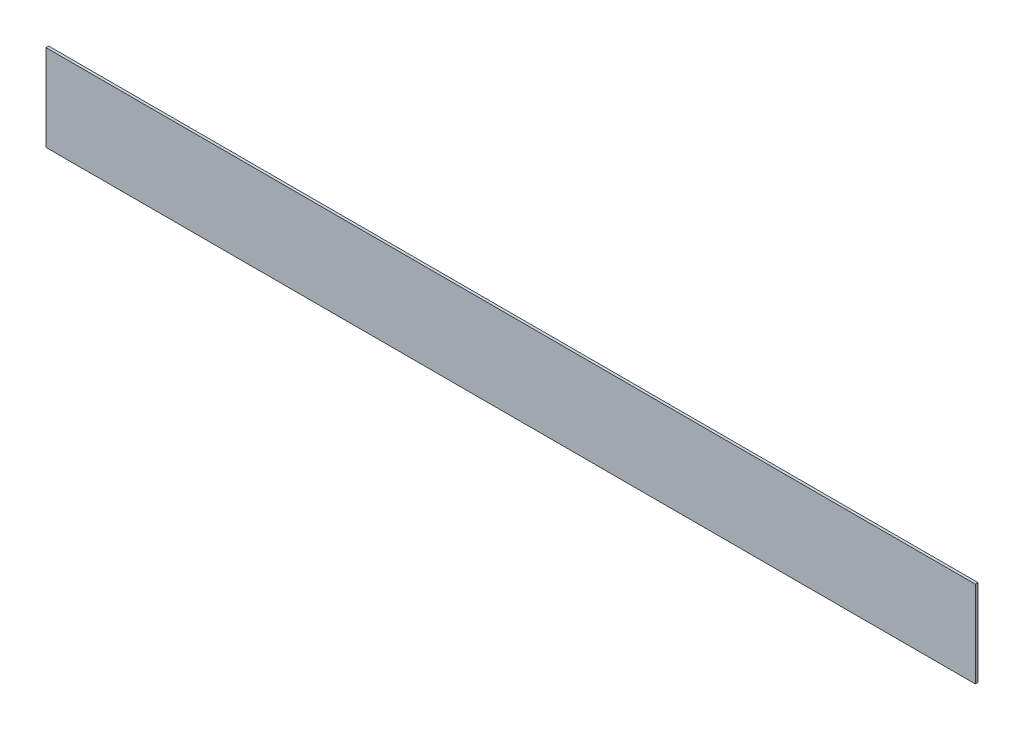
from build123d import *

# Parameters (mm, degrees)
SKETCH1_W           = 546.1
SKETCH1_H           = 50.8
BOSS_EXTRUDE1_DEPTH = 1.5875


with BuildPart() as part:
    # Sketch1 → Boss-Extrude1 (new body)
    with BuildSketch(Plane.XY):
        with Locations((273.05, 25.4)):
            Rectangle(SKETCH1_W, SKETCH1_H)
    extrude(amount=BOSS_EXTRUDE1_DEPTH)


solid = part.part
